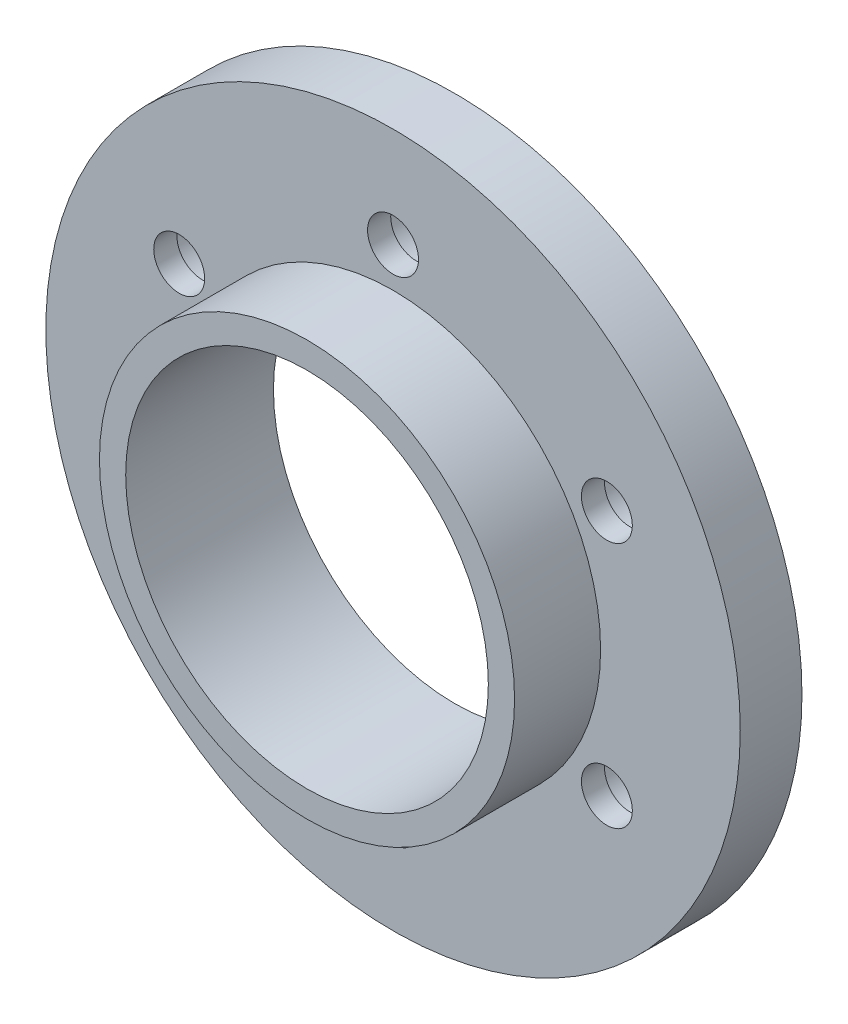
from build123d import *

# Parameters (mm, degrees)
SKETCH2_R                               = 45
BOSS_EXTRUDE1_DEPTH                     = 8
SKETCH5_R                               = 23.5
CUT_EXTRUDE1_DEPTH                      = 65.140470843
SKETCH6_R                               = 26.9
BOSS_EXTRUDE2_DEPTH                     = 11.148
SKETCH7_R                               = 23.5
CUT_EXTRUDE3_DEPTH                      = 67.457850582
CBORE_FOR_M8_HEX_HEAD_BOLT1_D           = 6.6
CBORE_FOR_M8_HEX_HEAD_BOLT1_CBORE_D     = 10
CBORE_FOR_M8_HEX_HEAD_BOLT1_CBORE_DEPTH = 5
CIRPATTERN1_COUNT                       = 6


with BuildPart() as part:
    # Sketch2 → Boss-Extrude1 (new body)
    with BuildSketch(Plane.XY):
        Circle(SKETCH2_R)
    extrude(amount=BOSS_EXTRUDE1_DEPTH)

    # Sketch5 → Cut-Extrude1 (cut, through all)
    with BuildSketch(Plane.XY.offset(8)):
        Circle(SKETCH5_R)
    extrude(amount=-CUT_EXTRUDE1_DEPTH, mode=Mode.SUBTRACT)

    # Sketch6 → Boss-Extrude2 (add)
    with BuildSketch(Plane.XY.offset(8)):
        Circle(SKETCH6_R)
    extrude(amount=BOSS_EXTRUDE2_DEPTH)

    # Sketch7 → Cut-Extrude3 (cut, through all)
    with BuildSketch(Plane.XY.offset(19.148)):
        Circle(SKETCH7_R)
    extrude(amount=-CUT_EXTRUDE3_DEPTH, mode=Mode.SUBTRACT)

    # CBORE for M8 Hex Head Bolt1 (through all)
    with Locations(Plane(origin=(0, 32, 0), x_dir=(-1, 0, 0), z_dir=(0, 0, -1))):
        with Locations((0, 0)):
            cbore_for_m8_hex_head_bolt1 = CounterBoreHole(CBORE_FOR_M8_HEX_HEAD_BOLT1_D / 2, CBORE_FOR_M8_HEX_HEAD_BOLT1_CBORE_D / 2, CBORE_FOR_M8_HEX_HEAD_BOLT1_CBORE_DEPTH)

    # CirPattern1: CBORE for M8 Hex Head Bolt1 ×6 about axis
    cirpattern1_axis = Axis((0, 0, 0), (0, 0, 1))
    for i in range(1, CIRPATTERN1_COUNT):
        add(cbore_for_m8_hex_head_bolt1.rotate(cirpattern1_axis, i * 360 / CIRPATTERN1_COUNT), mode=Mode.SUBTRACT)


solid = part.part
